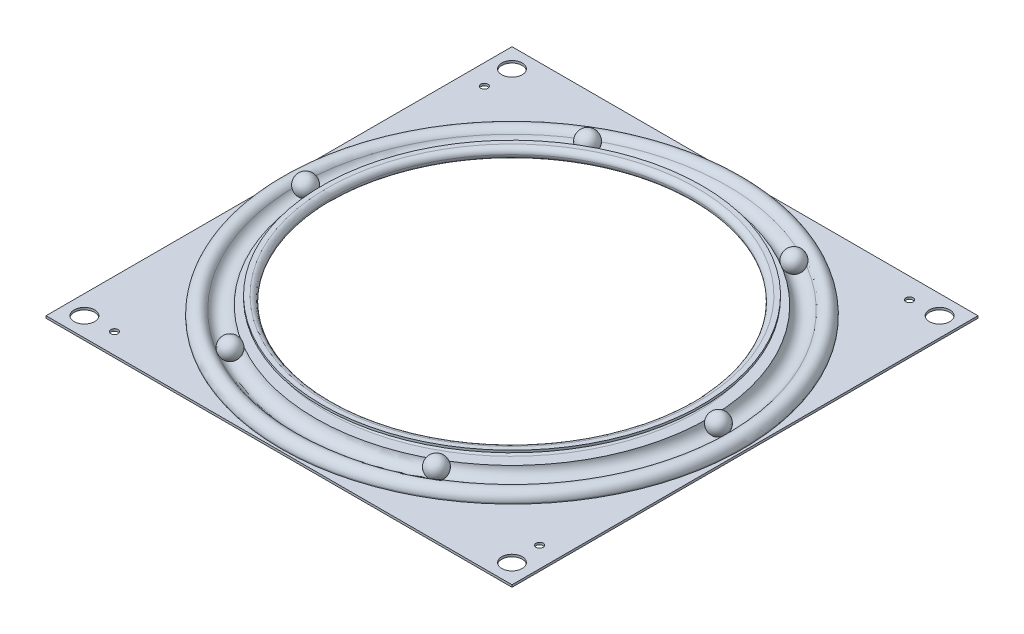
from build123d import *

# Parameters (mm, degrees)
SKETCH2_W                                 = 154.0002
SKETCH2_H                                 = 154.0002
SKETCH2_R                                 = 75.529340861
EXTRUDE1_DEPTH                            = 0.7366
EXTRUDE2_START                            = -0.7366
SKETCH3_R                                 = 75.529340861
EXTRUDE2_DEPTH                            = 0.7366
CIRPATTERN1_COUNT                         = 6
SKETCH5_W                                 = 3.3782
SKETCH5_H                                 = 0.7366
F_5_32_0_156250_DIAMETER_HOLE1_AT_2_COUNT = 2
F_5_32_0_156250_DIAMETER_HOLE1_AT_2_PITCH = 141.3002
F_5_32_0_156250_DIAMETER_HOLE1_AT_3_COUNT = 2
F_5_32_0_156250_DIAMETER_HOLE1_AT_3_PITCH = 141.3002
F_5_32_0_156250_DIAMETER_HOLE1_AT_4_COUNT = 2
F_5_32_0_156250_DIAMETER_HOLE1_AT_4_PITCH = 199.828659206
SKETCH7_W                                 = 2.3876
SKETCH7_H                                 = 8.128
F_5_32_0_156250_DIAMETER_HOLE2_AT_2_COUNT = 2
F_5_32_0_156250_DIAMETER_HOLE2_AT_2_PITCH = 121.0564
F_5_32_0_156250_DIAMETER_HOLE2_AT_3_COUNT = 2
F_5_32_0_156250_DIAMETER_HOLE2_AT_3_PITCH = 171.199602692
F_5_32_0_156250_DIAMETER_HOLE2_AT_4_COUNT = 2
F_5_32_0_156250_DIAMETER_HOLE2_AT_4_PITCH = 121.0564
CIRPATTERN2_COUNT                         = 4


# Read off the part's stored shape, not the designer's step: Revolve-Thin5
with BuildPart() as part:
    # Sketch1 → Revolve-Thin4 (revolve)
    with BuildSketch(Plane.XY, mode=Mode.PRIVATE) as revolve_thin4_sk:
        with BuildLine():
            Line((62.74854946, 1.778), (61.214, 1.778))
            ThreePointArc((61.214, 1.778), (59.436, 0), (61.214, -1.778))
            Line((61.214, -1.778), (64.28309892, -1.778))
            ThreePointArc((64.28309892, -1.778), (67.669225582, -4.788771381), (71.737577241, -2.794))
            ThreePointArc((71.737577241, -2.794), (74.023261161, -1.847238721), (75.529340861, -3.81))
            Line((75.529340861, -3.81), (75.529340861, -4.826))
            Line((75.529340861, -4.826), (77.0001, -4.826))
            Line((77.0001, -4.826), (77.0001, -4.0894))
            Line((77.0001, -4.0894), (76.265940861, -4.0894))
            Line((76.265940861, -4.0894), (76.265940861, -3.81))
            ThreePointArc((76.265940861, -3.81), (74.21390727, -1.135737757), (71.099662929, -2.4257))
            ThreePointArc((71.099662929, -2.4257), (67.492675346, -4.00937161), (64.902401285, -1.0414))
            Line((64.902401285, -1.0414), (61.214, -1.0414))
            ThreePointArc((61.214, -1.0414), (60.1726, 0), (61.214, 1.0414))
            Line((61.214, 1.0414), (62.74854946, 1.0414))
            Line((62.74854946, 1.0414), (62.74854946, 1.778))
        make_face()
    revolve(revolve_thin4_sk.sketch.rotate(Axis((0, 21.71272626, 0), (0, -1, 0)), 90), axis=Axis((0, 21.71272626, 0), (0, -1, 0)))

    # Sketch2 → Extrude1 (add)
    with BuildSketch(Plane.XZ.offset(4.826)):
        Rectangle(SKETCH2_W, SKETCH2_H)
        with Locations(Location((0, 0, 0), (0, 0, 90))):
            Circle(SKETCH2_R, mode=Mode.SUBTRACT)
    extrude(amount=-EXTRUDE1_DEPTH)

    # Sketch5 → 5/32 (0.156250) Diameter Hole1 (revolve, cut)
    with BuildSketch(Plane(origin=(70.6501, -4.0894, -70.6501), x_dir=(0, 0, 1), z_dir=(1, 0, 0))):
        with Locations((1.6891, 0.3683)):
            Rectangle(SKETCH5_W, SKETCH5_H)
    f_5_32_0_156250_diameter_hole1 = revolve(axis=Axis((70.6501, 2.2606, -70.6501), (0, -1, 0)), mode=Mode.SUBTRACT)

    # 5/32 (0.156250) Diameter Hole1 at 2: 5/32 (0.156250) Diameter Hole1 ×2
    with Locations(*[(0, 0, i * F_5_32_0_156250_DIAMETER_HOLE1_AT_2_PITCH) for i in range(1, F_5_32_0_156250_DIAMETER_HOLE1_AT_2_COUNT)]):
        add(f_5_32_0_156250_diameter_hole1, mode=Mode.SUBTRACT)

    # 5/32 (0.156250) Diameter Hole1 at 3: 5/32 (0.156250) Diameter Hole1 ×2
    with Locations(*[(-i * F_5_32_0_156250_DIAMETER_HOLE1_AT_3_PITCH, 0, 0) for i in range(1, F_5_32_0_156250_DIAMETER_HOLE1_AT_3_COUNT)]):
        add(f_5_32_0_156250_diameter_hole1, mode=Mode.SUBTRACT)

    # 5/32 (0.156250) Diameter Hole1 at 4: 5/32 (0.156250) Diameter Hole1 ×2
    with Locations(*[Vector(-0.7071067811865476, 0, 0.7071067811865476) * (i * F_5_32_0_156250_DIAMETER_HOLE1_AT_4_PITCH) for i in range(1, F_5_32_0_156250_DIAMETER_HOLE1_AT_4_COUNT)]):
        add(f_5_32_0_156250_diameter_hole1, mode=Mode.SUBTRACT)

    # Sketch11 → 3/32 (0.093750) Diameter Hole2 (revolve, cut)
    with BuildSketch(Plane(origin=(-70.2437, -4.0894, -61.1251), x_dir=(0, 0, 1), z_dir=(1, 0, 0))):
        Polygon((0, 0), (0, 26.115399675), (1.190625, 25.4), (1.190625, 0), align=None)
    f_3_32_0_093750_diameter_hole2 = revolve(axis=Axis((-70.2437, 2.2606, -61.1251), (0, -1, 0)), mode=Mode.SUBTRACT)

    # CirPattern2: 3/32 (0.093750) Diameter Hole2 ×4 about axis
    cirpattern2_axis = Axis((0, 0, 0), (0, 1, 0))
    for i in range(1, CIRPATTERN2_COUNT):
        add(f_3_32_0_093750_diameter_hole2.rotate(cirpattern2_axis, i * 360 / CIRPATTERN2_COUNT), mode=Mode.SUBTRACT)


with BuildPart() as body_2:
    # Revolve-Thin5 outline → Revolve-Thin5 (revolve)
    with BuildSketch(Plane.XY):
        with BuildLine():
            Line((76.265940861, 2.5654), (77.0001, 2.5654))
            Line((77.0001, 2.5654), (77.0001, 3.302))
            Line((77.0001, 3.302), (75.529340861, 3.302))
            Line((75.529340861, 3.302), (75.529340861, 2.286))
            ThreePointArc((75.529340861, 2.286), (74.023261161, 0.323238721), (71.737577241, 1.27))
            ThreePointArc((71.737577241, 1.27), (68.088390068, 3.299931105), (64.576093872, 1.0414))
            Line((64.576093872, 1.0414), (61.214, 1.0414))
            Line((61.214, 1.0414), (61.214, 0.3048))
            Line((61.214, 0.3048), (65.066299927, 0.3048))
            ThreePointArc((65.066299927, 0.3048), (67.890458911, 2.54923464), (71.099662929, 0.9017))
            ThreePointArc((71.099662929, 0.9017), (74.21390727, -0.388262243), (76.265940861, 2.286))
            Line((76.265940861, 2.286), (76.265940861, 2.5654))
        make_face()
    revolve(axis=Axis((0, 0, 0), (0, 1, 0)))

    # Sketch3 → Extrude2 (add)
    with BuildSketch(Plane(origin=(0, 3.302, 0), x_dir=(-1, 0, 0), z_dir=(0, 1, 0)).offset(EXTRUDE2_START)):
        Polygon((0, -108.894585724), (108.894585724, 0), (0, 108.894585724), (-108.894585724, 0), align=None)
        with Locations(Location((0, 0, 0), (0, 0, 90))):
            Circle(SKETCH3_R, mode=Mode.SUBTRACT)
    extrude(amount=EXTRUDE2_DEPTH)

    # Sketch7 → 5/32 (0.156250) Diameter Hole2 (revolve, cut)
    with BuildSketch(Plane(origin=(85.599801346, 3.302, 0), x_dir=(0, 0, 1), z_dir=(1, 0, 0))):
        with Locations((1.1938, 4.064)):
            Rectangle(SKETCH7_W, SKETCH7_H)
    f_5_32_0_156250_diameter_hole2 = revolve(axis=Axis((85.599801346, 9.652, 0), (0, -1, 0)), mode=Mode.SUBTRACT)

    # 5/32 (0.156250) Diameter Hole2 at 2: 5/32 (0.156250) Diameter Hole2 ×2
    with Locations(*[Vector(-0.7071067811865476, 0, -0.7071067811865476) * (i * F_5_32_0_156250_DIAMETER_HOLE2_AT_2_PITCH) for i in range(1, F_5_32_0_156250_DIAMETER_HOLE2_AT_2_COUNT)]):
        add(f_5_32_0_156250_diameter_hole2, mode=Mode.SUBTRACT)

    # 5/32 (0.156250) Diameter Hole2 at 3: 5/32 (0.156250) Diameter Hole2 ×2
    with Locations(*[(-i * F_5_32_0_156250_DIAMETER_HOLE2_AT_3_PITCH, 0, 0) for i in range(1, F_5_32_0_156250_DIAMETER_HOLE2_AT_3_COUNT)]):
        add(f_5_32_0_156250_diameter_hole2, mode=Mode.SUBTRACT)

    # 5/32 (0.156250) Diameter Hole2 at 4: 5/32 (0.156250) Diameter Hole2 ×2
    with Locations(*[Vector(-0.7071067811865476, 0, 0.7071067811865476) * (i * F_5_32_0_156250_DIAMETER_HOLE2_AT_4_PITCH) for i in range(1, F_5_32_0_156250_DIAMETER_HOLE2_AT_4_COUNT)]):
        add(f_5_32_0_156250_diameter_hole2, mode=Mode.SUBTRACT)


with BuildPart() as body_3:
    # Sketch4 → Revolve1 (revolve)
    with BuildSketch(Plane.XY):
        with BuildLine():
            Line((68.21805, 2.5146), (68.21805, -4.0386))
            ThreePointArc((68.21805, -4.0386), (71.49465, -0.762), (68.21805, 2.5146))
        make_face()
    revolve(axis=Axis((68.21805, 2.837450101, 0), (0, -1, 0)))


with BuildPart() as cirpattern1_1:
    # CirPattern1: pattern copy
    add(body_3.part.rotate(Axis((0, 0, 0), (0, 1, 0)), 1 * 360 / CIRPATTERN1_COUNT))


with BuildPart() as cirpattern1_2:
    # CirPattern1: pattern copy
    add(body_3.part.rotate(Axis((0, 0, 0), (0, 1, 0)), 2 * 360 / CIRPATTERN1_COUNT))


with BuildPart() as cirpattern1_3:
    # CirPattern1: pattern copy
    add(body_3.part.rotate(Axis((0, 0, 0), (0, 1, 0)), 3 * 360 / CIRPATTERN1_COUNT))


with BuildPart() as cirpattern1_4:
    # CirPattern1: pattern copy
    add(body_3.part.rotate(Axis((0, 0, 0), (0, 1, 0)), 4 * 360 / CIRPATTERN1_COUNT))


with BuildPart() as cirpattern1_5:
    # CirPattern1: pattern copy
    add(body_3.part.rotate(Axis((0, 0, 0), (0, 1, 0)), 5 * 360 / CIRPATTERN1_COUNT))


solid = Compound([part.part, body_3.part, cirpattern1_1.part, cirpattern1_2.part, cirpattern1_3.part, cirpattern1_4.part, cirpattern1_5.part])
